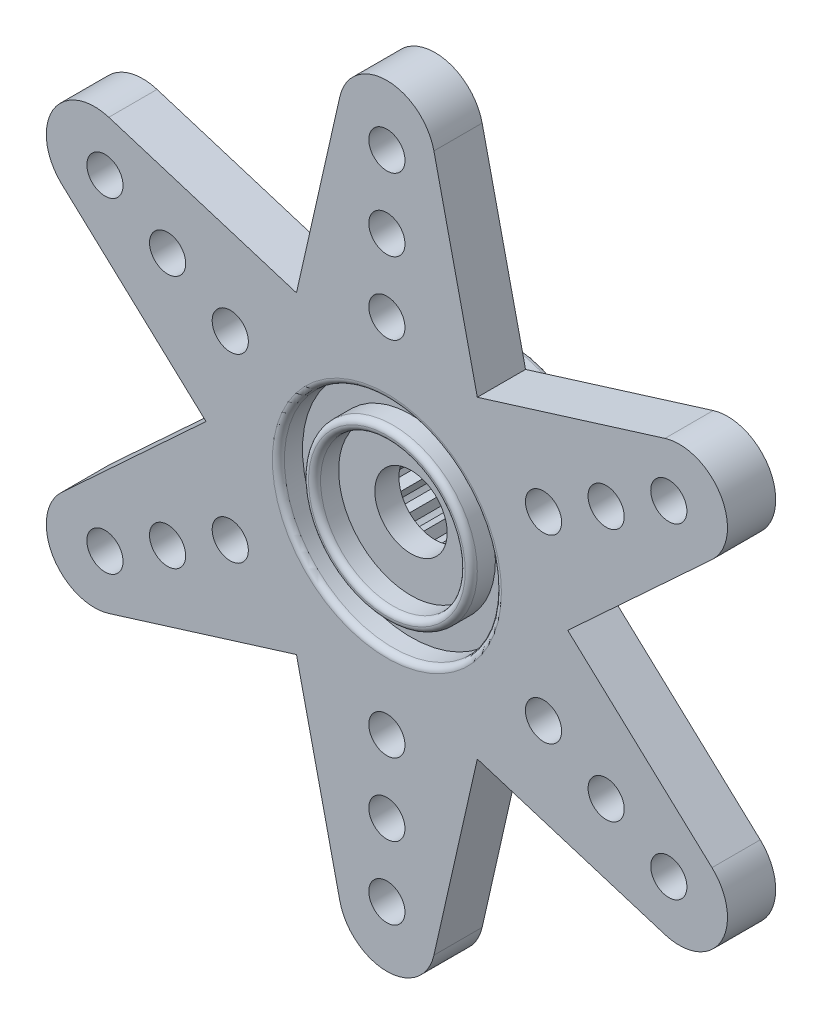
from build123d import *

# Parameters (mm, degrees)
ESQUISSE1_R                  = 4.25
ESQUISSE1_R_2                = 1.5
BOSS_EXTRU_1_DEPTH           = 5
ESQUISSE2_R                  = 3
ENL_V_MAT_EXTRU_1_DEPTH      = 3
BOSS_EXTRU_2_DEPTH           = 3
R_P_TITION_CIRCULAIRE1_DEPTH = 3
ESQUISSE4_R                  = 0.75
BOSS_EXTRU_3_DEPTH           = 2
R_P_TITION_CIRCULAIRE2_COUNT = 6
ENL_V_START                  = -1
ESQUISSE5_R                  = 3
ENL_V_MAT_EXTRU_2_DEPTH      = 1
CONG_1_R                     = 0.2
ESQUISSE6_R                  = 4.5
ESQUISSE6_R_2                = 3.5
ENL_V_MAT_EXTRU_3_DEPTH      = 1
CONG_2_R                     = 0.25


# Read off the part's stored shape, not the designer's step: Répétition circulaire1
with BuildPart() as part:
    # Esquisse1 → Boss.-Extru.1 (new body)
    with BuildSketch(Plane.XY):
        Circle(ESQUISSE1_R)
        Circle(ESQUISSE1_R_2, mode=Mode.SUBTRACT)
    extrude(amount=BOSS_EXTRU_1_DEPTH)

    # Esquisse2 → Enlèv. mat.-Extru.1 (cut)
    with BuildSketch(Plane(origin=(0, 0, 0), x_dir=(-1, 0, 0), z_dir=(0, 0, -1))):
        Circle(ESQUISSE2_R)
    extrude(amount=-ENL_V_MAT_EXTRU_1_DEPTH, mode=Mode.SUBTRACT)

    # Esquisse3 → Boss.-Extru.2 (add)
    with BuildSketch(Plane(origin=(0, 0, 0), x_dir=(-1, 0, 0), z_dir=(0, 0, -1))):
        Polygon((-0.3, 3), (0, 2.6), (0.3, 3), align=None)
    extrude(amount=-BOSS_EXTRU_2_DEPTH)

    # Répétition circulaire1 outline → Répétition circulaire1 (add)
    with BuildSketch(Plane.XY):
        with BuildLine():
            ThreePointArc((1.052468236, 2.80932565), (0.776457135, 2.897777479), (0.493198596, 2.959181499))
            Line((0.493198596, 2.959181499), (0.672929517, 2.511407148))
            Line((0.672929517, 2.511407148), (1.052468236, 2.80932565))
        make_face()
        with BuildLine():
            ThreePointArc((-0.493198596, 2.959181499), (-0.776457135, 2.897777479), (-1.052468236, 2.80932565))
            Line((-1.052468236, 2.80932565), (-0.672929517, 2.511407148))
            Line((-0.672929517, 2.511407148), (-0.493198596, 2.959181499))
        make_face()
        with BuildLine():
            ThreePointArc((-1.242285791, 2.730700645), (-1.5, 2.598076211), (-1.743713233, 2.441201376))
            Line((-1.743713233, 2.441201376), (-1.3, 2.25166605))
            Line((-1.3, 2.25166605), (-1.242285791, 2.730700645))
        make_face()
        with BuildLine():
            ThreePointArc((-1.906713263, 2.316127054), (-2.121320343, 2.121320343), (-2.316127054, 1.906713263))
            Line((-2.316127054, 1.906713263), (-1.838477631, 1.838477631))
            Line((-1.838477631, 1.838477631), (-1.906713263, 2.316127054))
        make_face()
        with BuildLine():
            ThreePointArc((-2.441201376, 1.743713233), (-2.598076211, 1.5), (-2.730700645, 1.242285791))
            Line((-2.730700645, 1.242285791), (-2.25166605, 1.3))
            Line((-2.25166605, 1.3), (-2.441201376, 1.743713233))
        make_face()
        with BuildLine():
            ThreePointArc((-2.809325651, 1.052468236), (-2.897777479, 0.776457135), (-2.959181499, 0.493198596))
            Line((-2.959181499, 0.493198596), (-2.511407148, 0.672929517))
            Line((-2.511407148, 0.672929517), (-2.809325651, 1.052468236))
        make_face()
        with BuildLine():
            ThreePointArc((-2.985999024, 0.289499268), (-3, 0), (-2.985999024, -0.289499268))
            Line((-2.985999024, -0.289499268), (-2.6, 0))
            Line((-2.6, 0), (-2.985999024, 0.289499268))
        make_face()
        with BuildLine():
            ThreePointArc((-2.959181499, -0.493198596), (-2.897777479, -0.776457135), (-2.809325651, -1.052468236))
            Line((-2.809325651, -1.052468236), (-2.511407148, -0.672929517))
            Line((-2.511407148, -0.672929517), (-2.959181499, -0.493198596))
        make_face()
        with BuildLine():
            ThreePointArc((-2.730700645, -1.242285791), (-2.598076211, -1.5), (-2.441201377, -1.743713233))
            Line((-2.441201377, -1.743713233), (-2.25166605, -1.3))
            Line((-2.25166605, -1.3), (-2.730700645, -1.242285791))
        make_face()
        with BuildLine():
            ThreePointArc((-2.316127055, -1.906713263), (-2.121320344, -2.121320344), (-1.906713263, -2.316127055))
            Line((-1.906713263, -2.316127055), (-1.838477631, -1.838477631))
            Line((-1.838477631, -1.838477631), (-2.316127055, -1.906713263))
        make_face()
        with BuildLine():
            ThreePointArc((-1.743713233, -2.441201377), (-1.5, -2.598076211), (-1.242285791, -2.730700645))
            Line((-1.242285791, -2.730700645), (-1.3, -2.25166605))
            Line((-1.3, -2.25166605), (-1.743713233, -2.441201377))
        make_face()
        with BuildLine():
            ThreePointArc((-1.052468236, -2.809325651), (-0.776457135, -2.897777479), (-0.493198596, -2.959181499))
            Line((-0.493198596, -2.959181499), (-0.672929517, -2.511407148))
            Line((-0.672929517, -2.511407148), (-1.052468236, -2.809325651))
        make_face()
        with BuildLine():
            ThreePointArc((-0.289499268, -2.985999024), (0, -3), (0.289499268, -2.985999024))
            Line((0.289499268, -2.985999024), (0, -2.6))
            Line((0, -2.6), (-0.289499268, -2.985999024))
        make_face()
        with BuildLine():
            ThreePointArc((0.493198596, -2.959181499), (0.776457135, -2.897777479), (1.052468236, -2.809325651))
            Line((1.052468236, -2.809325651), (0.672929517, -2.511407148))
            Line((0.672929517, -2.511407148), (0.493198596, -2.959181499))
        make_face()
        with BuildLine():
            ThreePointArc((1.242285791, -2.730700645), (1.5, -2.598076211), (1.743713233, -2.441201377))
            Line((1.743713233, -2.441201377), (1.3, -2.25166605))
            Line((1.3, -2.25166605), (1.242285791, -2.730700645))
        make_face()
        with BuildLine():
            ThreePointArc((1.906713263, -2.316127055), (2.121320344, -2.121320344), (2.316127055, -1.906713263))
            Line((2.316127055, -1.906713263), (1.838477631, -1.838477631))
            Line((1.838477631, -1.838477631), (1.906713263, -2.316127055))
        make_face()
        with BuildLine():
            ThreePointArc((2.441201377, -1.743713233), (2.598076211, -1.5), (2.730700645, -1.242285791))
            Line((2.730700645, -1.242285791), (2.25166605, -1.3))
            Line((2.25166605, -1.3), (2.441201377, -1.743713233))
        make_face()
        with BuildLine():
            ThreePointArc((2.809325651, -1.052468236), (2.897777479, -0.776457135), (2.959181499, -0.493198596))
            Line((2.959181499, -0.493198596), (2.511407148, -0.672929517))
            Line((2.511407148, -0.672929517), (2.809325651, -1.052468236))
        make_face()
        with BuildLine():
            ThreePointArc((2.985999024, -0.289499268), (3, 0), (2.985999024, 0.289499268))
            Line((2.985999024, 0.289499268), (2.6, 0))
            Line((2.6, 0), (2.985999024, -0.289499268))
        make_face()
        with BuildLine():
            ThreePointArc((2.959181499, 0.493198596), (2.897777479, 0.776457135), (2.809325651, 1.052468236))
            Line((2.809325651, 1.052468236), (2.511407148, 0.672929517))
            Line((2.511407148, 0.672929517), (2.959181499, 0.493198596))
        make_face()
        with BuildLine():
            ThreePointArc((2.730700645, 1.242285791), (2.598076211, 1.5), (2.441201376, 1.743713233))
            Line((2.441201376, 1.743713233), (2.25166605, 1.3))
            Line((2.25166605, 1.3), (2.730700645, 1.242285791))
        make_face()
        with BuildLine():
            ThreePointArc((2.316127054, 1.906713263), (2.121320343, 2.121320343), (1.906713263, 2.316127054))
            Line((1.906713263, 2.316127054), (1.838477631, 1.838477631))
            Line((1.838477631, 1.838477631), (2.316127054, 1.906713263))
        make_face()
        with BuildLine():
            ThreePointArc((1.743713233, 2.441201376), (1.5, 2.598076211), (1.242285791, 2.730700645))
            Line((1.242285791, 2.730700645), (1.3, 2.25166605))
            Line((1.3, 2.25166605), (1.743713233, 2.441201376))
        make_face()
    extrude(amount=R_P_TITION_CIRCULAIRE1_DEPTH)

    # Esquisse4 → Boss.-Extru.3 (add)
    with BuildSketch(Plane.XY.offset(5)):
        with BuildLine():
            Line((-1.95061736, 14.441692106), (-3.75, 6.495190528))
            Line((-3.75, 6.495190528), (-3.75, 2))
            Line((-3.75, 2), (0, 3.364888378))
            Line((0, 3.364888378), (3.75, 2))
            Line((3.75, 2), (3.75, 6.495190528))
            Line((3.75, 6.495190528), (1.95061736, 14.441692106))
            ThreePointArc((1.95061736, 14.441692106), (0, 16), (-1.95061736, 14.441692106))
        make_face()
        with Locations((0, 7.5)):
            Circle(ESQUISSE4_R, mode=Mode.SUBTRACT)
        with Locations((0, 10.5)):
            Circle(ESQUISSE4_R, mode=Mode.SUBTRACT)
        with Locations((0, 13.5)):
            Circle(ESQUISSE4_R, mode=Mode.SUBTRACT)
    boss_extru_3 = extrude(amount=-BOSS_EXTRU_3_DEPTH)

    # Répétition circulaire2: Boss.-Extru.3 ×6 about axis
    r_p_tition_circulaire2_axis = Axis((0, 0, 0), (0, 0, 1))
    for i in range(1, R_P_TITION_CIRCULAIRE2_COUNT):
        add(boss_extru_3.rotate(r_p_tition_circulaire2_axis, i * 360 / R_P_TITION_CIRCULAIRE2_COUNT))

    # Esquisse5 → Enlèv. mat.-Extru.2 (cut)
    with BuildSketch(Plane.XY.offset(5).offset(ENL_V_START)):
        Circle(ESQUISSE5_R)
    extrude(amount=ENL_V_MAT_EXTRU_2_DEPTH, mode=Mode.SUBTRACT)

    # Congé1
    cong_1_edges = [part.edges().sort_by_distance(p)[0] for p in [
        (-4.25, 0, 0),
    ]]
    fillet(cong_1_edges, radius=CONG_1_R)

    # Esquisse6 → Enlèv. mat.-Extru.3 (cut)
    with BuildSketch(Plane.XY.offset(5)):
        Circle(ESQUISSE6_R)
        Circle(ESQUISSE6_R_2, mode=Mode.SUBTRACT)
    extrude(amount=-ENL_V_MAT_EXTRU_3_DEPTH, mode=Mode.SUBTRACT)

    # Congé2
    cong_2_edges = [part.edges().sort_by_distance(p)[0] for p in [
        (-3, 0, 5),
        (-4.5, 0, 5),
        (-3.5, 0, 5),
    ]]
    fillet(cong_2_edges, radius=CONG_2_R - 0.0001)  # a hair under: the kernel refuses the full size


solid = part.part
